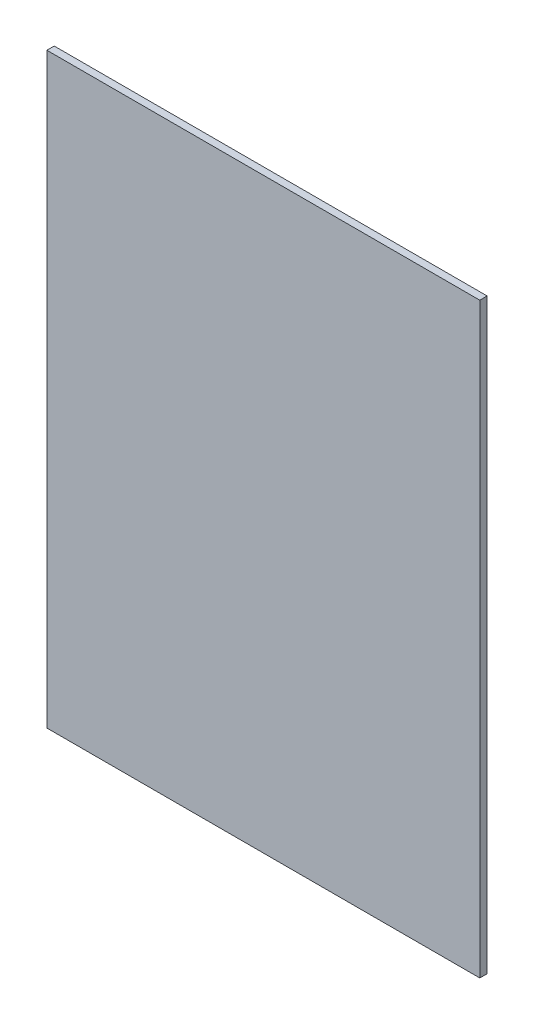
from build123d import *

# Parameters (mm, degrees)
SKETCH1_W           = 187.325
SKETCH1_H           = 254
BOSS_EXTRUDE1_DEPTH = 3.175


with BuildPart() as part:
    # Sketch1 → Boss-Extrude1 (new body)
    with BuildSketch(Plane.XY):
        Rectangle(SKETCH1_W, SKETCH1_H)
    extrude(amount=BOSS_EXTRUDE1_DEPTH)


solid = part.part
